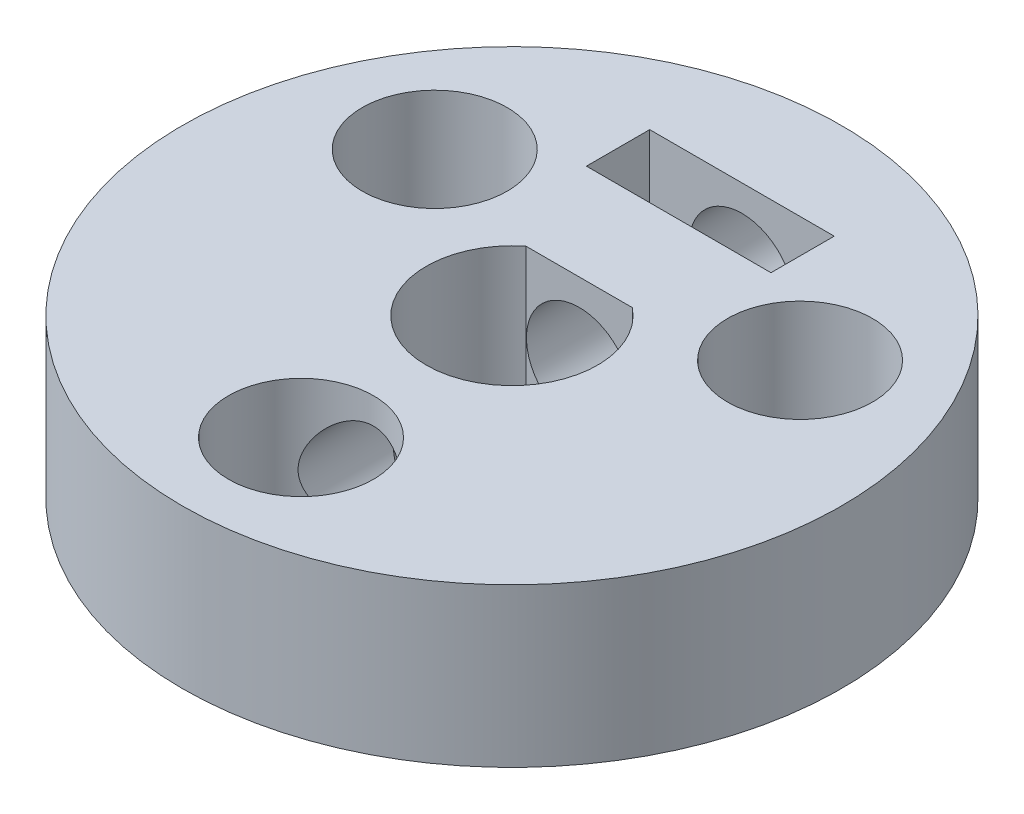
from build123d import *

# Parameters (mm, degrees)
SKETCH1_R                      = 12.5
BOSS_EXTRUDE1_DEPTH            = 6
CUT_EXTRUDE1_REACH             = 20.668
CUT_EXTRUDE2_REACH             = 20.668
SKETCH3_R                      = 2.75
CUT_EXTRUDE3_REACH             = 22.463
SKETCH4_R                      = 2
CUT_EXTRUDE3_DIRECTION_2_REACH = 22.463
CUT_EXTRUDE4_REACH             = 20.668
SKETCH5_W                      = 7
SKETCH5_H                      = 2.4


with BuildPart() as part:
    # Sketch1 → Boss-Extrude1 (new body)
    with BuildSketch(Plane(origin=(0, 0, 0), x_dir=(1, 0, 0), z_dir=(0, 1, 0))):
        Circle(SKETCH1_R)
    extrude(amount=BOSS_EXTRUDE1_DEPTH)

    # Sketch2 → Cut-Extrude1 (cut, up to next)
    with BuildSketch(Plane(origin=(0, 6, 0), x_dir=(1, 0, 0), z_dir=(0, 1, 0)), mode=Mode.PRIVATE) as cut_extrude1_sk1:
        with BuildLine():
            Line((2.014944168, 2.55), (-2.014944168, 2.55))
            ThreePointArc((-2.014944168, 2.55), (-1.416674178, -2.924984491), (3.25, 0))
            ThreePointArc((3.25, 0), (2.924984491, 1.416674178), (2.014944168, 2.55))
        make_face()
    cut_extrude1_tool1 = extrude(cut_extrude1_sk1.sketch, amount=-CUT_EXTRUDE1_REACH, mode=Mode.PRIVATE) & part.part
    add(cut_extrude1_tool1.solids().sort_by_distance((0, 6, 0.174477))[0], mode=Mode.SUBTRACT)

    # Sketch3 → Cut-Extrude2 (cut, up to next)
    with BuildSketch(Plane(origin=(0, 6, 0), x_dir=(1, 0, 0), z_dir=(0, 1, 0)), mode=Mode.PRIVATE) as cut_extrude2_sk1:
        with Locations((0, -8)):
            Circle(SKETCH3_R)
    cut_extrude2_tool1 = extrude(cut_extrude2_sk1.sketch, amount=-CUT_EXTRUDE2_REACH, mode=Mode.PRIVATE) & part.part
    # Sketch3 → Cut-Extrude2 (cut, up to next)
    with BuildSketch(Plane(origin=(0, 6, 0), x_dir=(1, 0, 0), z_dir=(0, 1, 0)), mode=Mode.PRIVATE) as cut_extrude2_sk2:
        with Locations((-6.92820323, 4)):
            Circle(SKETCH3_R)
    cut_extrude2_tool2 = extrude(cut_extrude2_sk2.sketch, amount=-CUT_EXTRUDE2_REACH, mode=Mode.PRIVATE) & part.part
    # Sketch3 → Cut-Extrude2 (cut, up to next)
    with BuildSketch(Plane(origin=(0, 6, 0), x_dir=(1, 0, 0), z_dir=(0, 1, 0)), mode=Mode.PRIVATE) as cut_extrude2_sk3:
        with Locations((6.92820323, 4)):
            Circle(SKETCH3_R)
    cut_extrude2_tool3 = extrude(cut_extrude2_sk3.sketch, amount=-CUT_EXTRUDE2_REACH, mode=Mode.PRIVATE) & part.part
    add(cut_extrude2_tool1.solids().sort_by_distance((0, 6, 8))[0], mode=Mode.SUBTRACT)
    add(cut_extrude2_tool2.solids().sort_by_distance((-6.928203, 6, -4))[0], mode=Mode.SUBTRACT)
    add(cut_extrude2_tool3.solids().sort_by_distance((6.928203, 6, -4))[0], mode=Mode.SUBTRACT)

    # Sketch4 → Cut-Extrude3 (cut, up to next)
    with BuildSketch(Plane.XY.offset(-2.55), mode=Mode.PRIVATE) as cut_extrude3_sk1:
        with Locations((0, 3)):
            Circle(SKETCH4_R)
    cut_extrude3_tool1 = extrude(cut_extrude3_sk1.sketch, amount=-CUT_EXTRUDE3_REACH, mode=Mode.PRIVATE) & part.part
    add(cut_extrude3_tool1.solids().sort_by_distance((0, 3, -2.55))[0], mode=Mode.SUBTRACT)

    # Sketch4 → Cut-Extrude3 direction 2 (cut, up to next)
    with BuildSketch(Plane.XY.offset(-2.55), mode=Mode.PRIVATE) as cut_extrude3_direction_2_sk1:
        with Locations((0, 3)):
            Circle(SKETCH4_R)
    cut_extrude3_direction_2_tool1 = extrude(cut_extrude3_direction_2_sk1.sketch, amount=CUT_EXTRUDE3_DIRECTION_2_REACH, mode=Mode.PRIVATE) & part.part
    add(cut_extrude3_direction_2_tool1.solids().sort_by_distance((0, 3, -2.55))[0], mode=Mode.SUBTRACT)

    # Sketch5 → Cut-Extrude4 (cut, up to next)
    with BuildSketch(Plane(origin=(0, 6, 0), x_dir=(1, 0, 0), z_dir=(0, 1, 0)), mode=Mode.PRIVATE) as cut_extrude4_sk1:
        with Locations((0, 7.525)):
            Rectangle(SKETCH5_W, SKETCH5_H)
    cut_extrude4_tool1 = extrude(cut_extrude4_sk1.sketch, amount=-CUT_EXTRUDE4_REACH, mode=Mode.PRIVATE) & part.part
    add(cut_extrude4_tool1.solids().sort_by_distance((0, 6, -7.525))[0], mode=Mode.SUBTRACT)


solid = part.part
